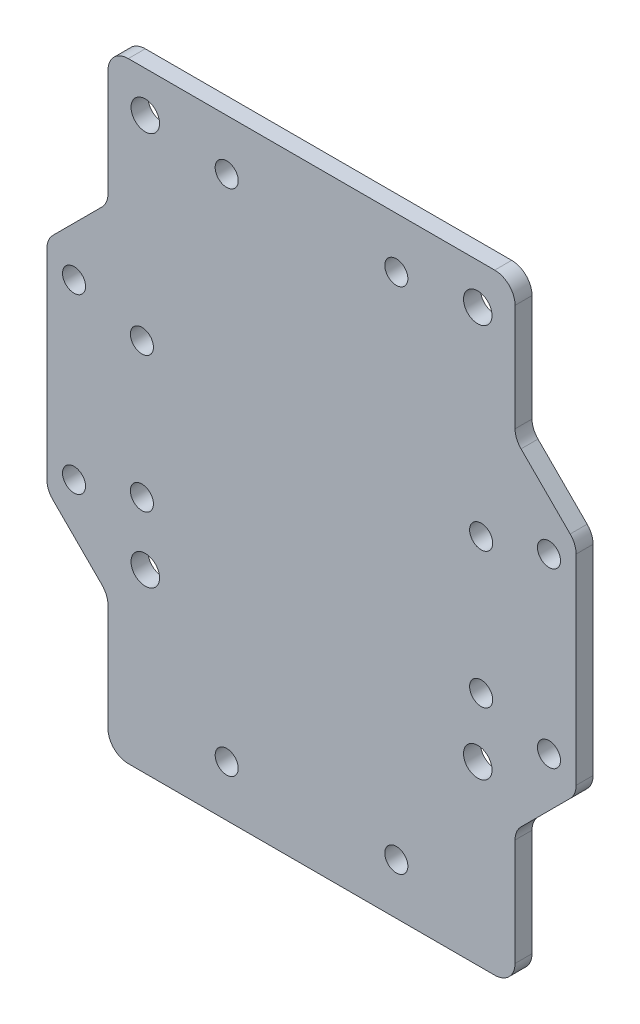
from build123d import *

# Parameters (mm, degrees)
BOSS_EXTRUDE1_DEPTH        = 1.25
FILLET1_R                  = 3
F_4_2_4_2_DIAMETER_HOLE1_D = 4.2
M3_CLEARANCE_HOLE1_D       = 3.4
M3_CLEARANCE_HOLE2_D       = 3.4


with BuildPart() as part:
    # Sketch1 → Boss-Extrude1 (new, symmetric)
    with BuildSketch(Plane.XY):
        Polygon((-39, 16), (-39, -16), (-30, -25), (-30, -45), (30, -45), (30, -25), (39, -16), (39, 16), (30, 25), (30, 45), (-30, 45), (-30, 25), align=None)
    extrude(amount=BOSS_EXTRUDE1_DEPTH, both=True)

    # Fillet1
    fillet1_edges = [part.edges().sort_by_distance(p)[0] for p in [
        (30, 45, 0),
        (30, -45, 0),
        (-30, -45, 0),
        (-30, 45, 0),
        (30, 25, 0),
        (39, 16, 0),
        (39, -16, 0),
        (30, -25, 0),
        (-30, -25, 0),
        (-39, -16, 0),
        (-39, 16, 0),
        (-30, 25, 0),
    ]]
    fillet(fillet1_edges, radius=FILLET1_R)

    # Ø4.2 (4.2) Diameter Hole1 (through all)
    with Locations(Plane(origin=(0, 0, -1.25), x_dir=(-1, 0, 0), z_dir=(0, 0, -1))):
        with Locations((-24.5, -19), (24.5, -19), (24.5, 39), (-24.5, 39)):
            Hole(F_4_2_4_2_DIAMETER_HOLE1_D / 2)

    # M3 Clearance Hole1 (through all)
    with Locations(Plane(origin=(0, 0, -1.25), x_dir=(-1, 0, 0), z_dir=(0, 0, -1))):
        with Locations((-35, 12.75), (-35, -12.75), (35, -12.75), (35, 12.75)):
            Hole(M3_CLEARANCE_HOLE1_D / 2)

    # M3 Clearance Hole2 (through all)
    with Locations(Plane.XY.offset(1.25)):
        with Locations((-12.5, -37.5), (12.5, -37.5), (-12.5, 37.5), (12.5, 37.5), (-25, 10), (-25, -10), (25, -10), (25, 10)):
            Hole(M3_CLEARANCE_HOLE2_D / 2)


solid = part.part
